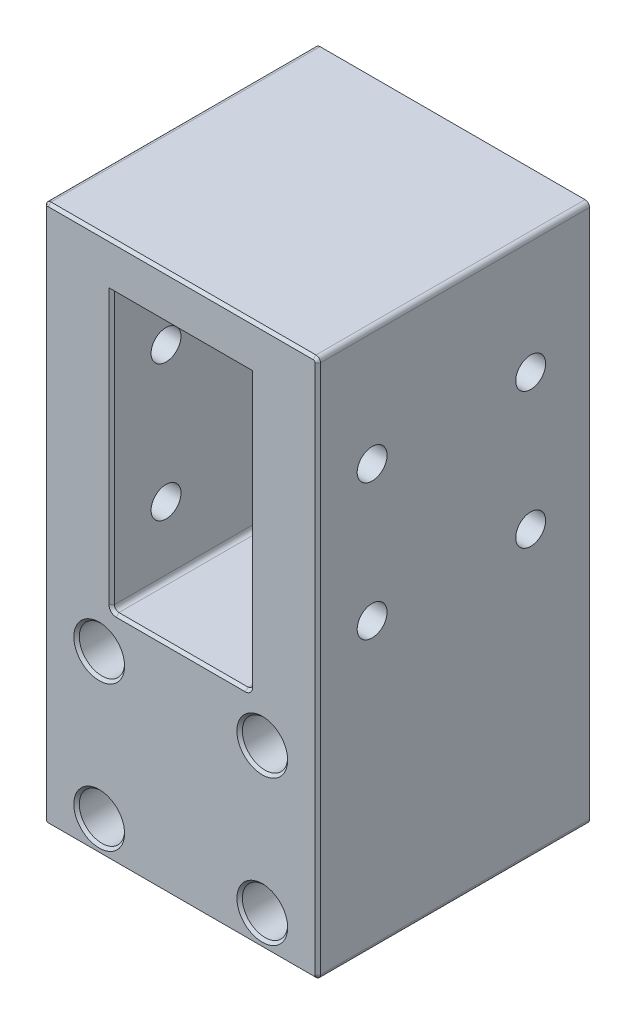
from build123d import *

# Parameters (mm, degrees)
BOSS_EXTRUDE1_DEPTH                                 = 60
CBORE_FOR_M5_HEX_SOCKET_HEAD_CAP_SCREW1_D           = 5.3
CBORE_FOR_M5_HEX_SOCKET_HEAD_CAP_SCREW1_CBORE_D     = 10
CBORE_FOR_M5_HEX_SOCKET_HEAD_CAP_SCREW1_CBORE_DEPTH = 17.4
M6_CLEARANCE_HOLE1_D                                = 6.6
M6_CLEARANCE_HOLE1_DEPTH                            = 15
SKETCH8_W                                           = 20
SKETCH8_H                                           = 3
BOSS_EXTRUDE2_DEPTH                                 = 10
SKETCH9_W                                           = 60.5
SKETCH9_H                                           = 10
BOSS_EXTRUDE3_DEPTH                                 = 60
FILLET1_R                                           = 1
FILLET2_R                                           = 6
FILLET2_R_2                                         = 1
CHAMFER1_SIZE                                       = 0.6


with BuildPart() as part:
    # Sketch1 → Boss-Extrude1 (new body)
    with BuildSketch(Plane.XY):
        Polygon((30.25, 0), (-30.25, 0), (-30.25, 109), (-15.25, 109), (-15.25, 48), (15.25, 48), (15.25, 109), (30.25, 109), align=None)
    extrude(amount=BOSS_EXTRUDE1_DEPTH)

    # CBORE for M5 Hex Socket Head Cap Screw1 (through all)
    with Locations(Plane.XY.offset(60)):
        with Locations((-18, 7), (18, 7), (18, 39), (-18, 39)):
            CounterBoreHole(CBORE_FOR_M5_HEX_SOCKET_HEAD_CAP_SCREW1_D / 2, CBORE_FOR_M5_HEX_SOCKET_HEAD_CAP_SCREW1_CBORE_D / 2, CBORE_FOR_M5_HEX_SOCKET_HEAD_CAP_SCREW1_CBORE_DEPTH)

    # M6 Clearance Hole1
    with Locations(Plane.ZY.offset(30.25)):
        with Locations((48, 93), (13, 93), (13, 63), (48, 63)):
            m6_clearance_hole1 = Hole(M6_CLEARANCE_HOLE1_D / 2, depth=M6_CLEARANCE_HOLE1_DEPTH)

    # Mirror1: M6 Clearance Hole1 across plane
    add(m6_clearance_hole1.mirror(Plane(origin=(0, 0, 0), x_dir=(0, 0, 1), z_dir=(1, 0, 0))), mode=Mode.SUBTRACT)

    # Sketch8 → Boss-Extrude2 (add)
    with BuildSketch(Plane(origin=(0, 0, 0), x_dir=(-1, 0, 0), z_dir=(0, 0, -1))):
        with Locations((0, 46.5)):
            Rectangle(SKETCH8_W, SKETCH8_H)
    extrude(amount=BOSS_EXTRUDE2_DEPTH)

    # Sketch9 → Boss-Extrude3 (add)
    with BuildSketch(Plane.XY.offset(60)):
        with Locations((0, 114)):
            Rectangle(SKETCH9_W, SKETCH9_H)
    extrude(amount=-BOSS_EXTRUDE3_DEPTH)

    # Fillet1
    fillet1_edges = [part.edges().sort_by_distance(p)[0] for p in [
        (30.25, 119, 30),
        (-30.25, 119, 30),
        (-15.25, 48, 30),
        (15.25, 48, 30),
        (30.25, 0, 30),
        (-30.25, 0, 30),
    ]]
    fillet(fillet1_edges, radius=FILLET1_R)

    # Fillet2
    # the kernel refuses this fillet: 6, 1 mm, written as the material it adds along each edge
    with BuildSketch(Plane(origin=(10, 45, 0), x_dir=(1, 0, 0), z_dir=(0, 1, 0)), Plane(origin=(-10, 48, 0), x_dir=(-1, 0, 0), z_dir=(0, -1, 0))) as fillet2_piece_1:
        with BuildLine():
            CenterArc((FILLET2_R, FILLET2_R), FILLET2_R, 180, 90)
            Line((0, FILLET2_R), (0, 0))
            Line((0, 0), (FILLET2_R, 0))
        make_face()
    extrude(amount=3)
    # the kernel refuses this fillet: 6, 1 mm, written as the material it takes off along each edge
    with BuildSketch(Plane(origin=(10, 42.5, -10), x_dir=(-1, 0, 0), z_dir=(0, 1, 0))) as fillet2_2_piece_1:
        with BuildLine():
            CenterArc((FILLET2_R_2, FILLET2_R_2), FILLET2_R_2, 180, 90)
            Line((0, FILLET2_R_2), (0, 0))
            Line((0, 0), (FILLET2_R_2, 0))
        make_face()
    extrude(amount=8, mode=Mode.SUBTRACT)
    with BuildSketch(Plane(origin=(-10, 50.5, -10), x_dir=(0, 0, 1), z_dir=(0, -1, 0))) as fillet2_2_piece_2:
        with BuildLine():
            CenterArc((FILLET2_R_2, -FILLET2_R_2), FILLET2_R_2, 90, 90)
            Line((0, -FILLET2_R_2), (0, 0))
            Line((0, 0), (FILLET2_R_2, 0))
        make_face()
    extrude(amount=8, mode=Mode.SUBTRACT)

    # Chamfer1
    chamfer1_edges = [part.edges().sort_by_distance(p)[0] for p in [
        (0, 109, 60),
        (0, 119, 60),
        (-30.25, 59.5, 60),
        (0, 0, 60),
        (30.25, 59.5, 60),
        (-15.25, 79, 60),
        (0, 48, 60),
        (-29.957106781, 0.292893219, 60),
        (29.957106781, 0.292893219, 60),
        (29.957106781, 118.707106781, 60),
        (-29.957106781, 118.707106781, 60),
        (14.957106781, 48.292893219, 60),
        (-14.957106781, 48.292893219, 60),
        (15.25, 79, 60),
        (-23, 39, 60),
        (13, 39, 60),
        (13, 7, 60),
        (-23, 7, 60),
    ]]
    chamfer(chamfer1_edges, length=CHAMFER1_SIZE)


solid = part.part
